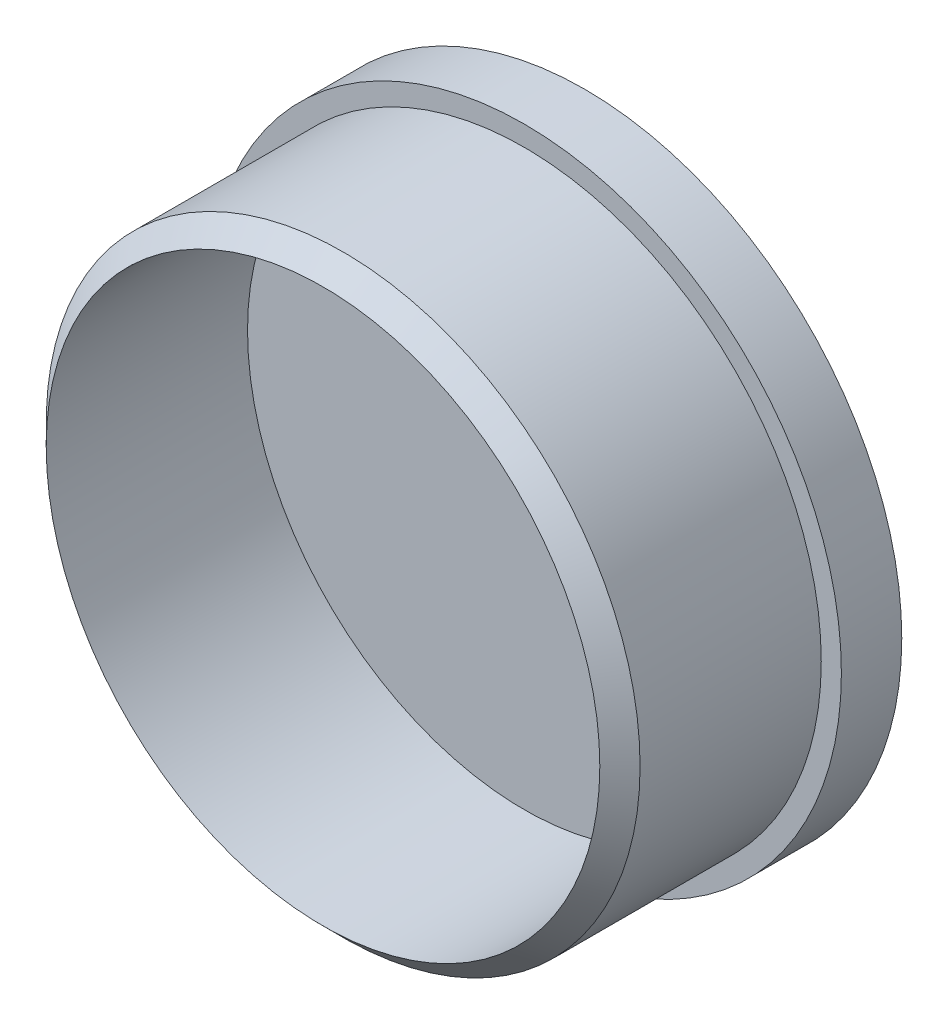
from build123d import *

# Parameters (mm, degrees)
ESBO_O1_R                = 31.5
RESSALTO_EXTRUS_O1_DEPTH = 6
ESBO_O2_R                = 29.5
ESBO_O2_R_2              = 27.5
RESSALTO_EXTRUS_O2_DEPTH = 20
CHANFRO1_SIZE            = 2


with BuildPart() as part:
    # Esboço1 → Ressalto-extrusão1 (new body)
    with BuildSketch(Plane.XY):
        Circle(ESBO_O1_R)
    extrude(amount=RESSALTO_EXTRUS_O1_DEPTH)

    # Esboço2 → Ressalto-extrusão2 (add)
    with BuildSketch(Plane.XY.offset(6)):
        Circle(ESBO_O2_R)
        Circle(ESBO_O2_R_2, mode=Mode.SUBTRACT)
    extrude(amount=RESSALTO_EXTRUS_O2_DEPTH)

    # Chanfro1
    chanfro1_edges = [part.edges().sort_by_distance(p)[0] for p in [
        (-29.5, 0, 26),
    ]]
    chamfer(chanfro1_edges, length=CHANFRO1_SIZE - 0.0001)  # a hair under: the kernel refuses the full size


solid = part.part
